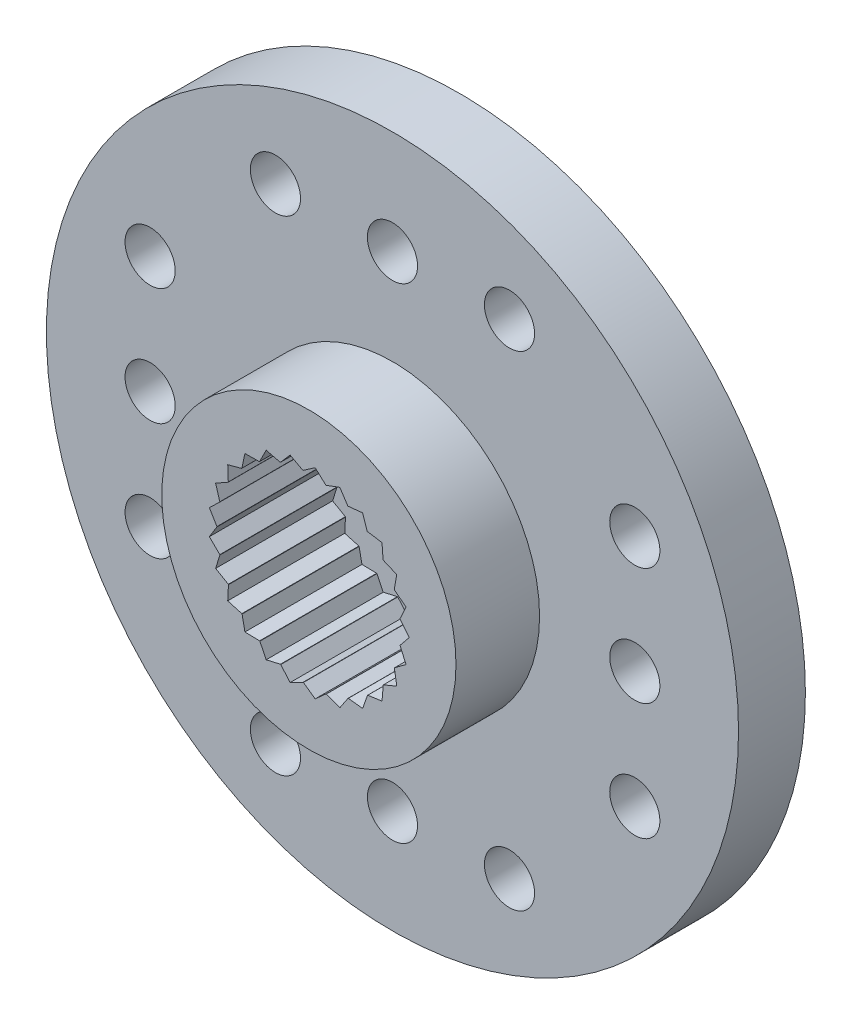
from build123d import *

# Parameters (mm, degrees)
SKETCH1_R             = 10.35
SKETCH1_R_2           = 4.4
SKETCH1_R_3           = 0.75
BOSS_EXTRUDE1_DEPTH   = 2
CIRPATTERN2_OUTLINE_R = 0.75
CIRPATTERN2_DEPTH     = 2
SKETCH1_2_R           = 4.4
BOSS_EXTRUDE2_DEPTH   = 4.5
SKETCH2_R             = 1.5
CUT_EXTRUDE1_DEPTH    = 4.5
SKETCH3_R             = 2.75
CUT_EXTRUDE2_DEPTH    = 3.5
CUT_EXTRUDE3_DEPTH    = 3.5
CIRPATTERN1_COUNT     = 25


# Read off the part's stored shape, not the designer's step: CirPattern2
with BuildPart() as part:
    # Sketch1 → Boss-Extrude1 (new body)
    with BuildSketch(Plane.XY):
        Circle(SKETCH1_R)
        Circle(SKETCH1_R_2, mode=Mode.SUBTRACT)
        with Locations((0, 7.247764581)):
            Circle(SKETCH1_R_3, mode=Mode.SUBTRACT)
        with Locations((3.5, 7.247764581)):
            Circle(SKETCH1_R_3, mode=Mode.SUBTRACT)
        with Locations((-3.5, 7.247764581)):
            Circle(SKETCH1_R_3, mode=Mode.SUBTRACT)
    extrude(amount=BOSS_EXTRUDE1_DEPTH)

    # CirPattern2 outline → CirPattern2 (cut)
    with BuildSketch(Plane.XY):
        with Locations((7.247764581, 3.5)):
            Circle(CIRPATTERN2_OUTLINE_R)
        with Locations((7.247764581, 0)):
            Circle(CIRPATTERN2_OUTLINE_R)
        with Locations((7.247764581, -3.5)):
            Circle(CIRPATTERN2_OUTLINE_R)
        with Locations((3.5, -7.247764581)):
            Circle(CIRPATTERN2_OUTLINE_R)
        with Locations((0, -7.247764581)):
            Circle(CIRPATTERN2_OUTLINE_R)
        with Locations((-3.5, -7.247764581)):
            Circle(CIRPATTERN2_OUTLINE_R)
        with Locations((-7.247764581, -3.5)):
            Circle(CIRPATTERN2_OUTLINE_R)
        with Locations((-7.247764581, 0)):
            Circle(CIRPATTERN2_OUTLINE_R)
        with Locations((-7.247764581, 3.5)):
            Circle(CIRPATTERN2_OUTLINE_R)
    extrude(amount=CIRPATTERN2_DEPTH, mode=Mode.SUBTRACT)

    # Sketch1<2> → Boss-Extrude2 (add)
    with BuildSketch(Plane.XY):
        Circle(SKETCH1_2_R)
    extrude(amount=BOSS_EXTRUDE2_DEPTH)

    # Sketch2 → Cut-Extrude1 (cut)
    with BuildSketch(Plane(origin=(0, 0, 0), x_dir=(-1, 0, 0), z_dir=(0, 0, -1))):
        Circle(SKETCH2_R)
    extrude(amount=-CUT_EXTRUDE1_DEPTH, mode=Mode.SUBTRACT)

    # Sketch3 → Cut-Extrude2 (cut)
    with BuildSketch(Plane.XY.offset(4.5)):
        Circle(SKETCH3_R)
    extrude(amount=-CUT_EXTRUDE2_DEPTH, mode=Mode.SUBTRACT)

    # Sketch4 → Cut-Extrude3 (cut)
    with BuildSketch(Plane.XY.offset(4.5)):
        with BuildLine():
            Line((-2.976344104, 0.375999701), (-2.728315429, 0.344666392))
            ThreePointArc((-2.728315429, 0.344666392), (-2.70218519, 0.510583192), (-2.665974712, 0.674595311))
            Line((-2.665974712, 0.674595311), (-2.976344104, 0.375999701))
        make_face()
        with BuildLine():
            Line((-2.976344104, 0.375999701), (-2.75, 0))
            ThreePointArc((-2.75, 0), (-2.744573503, 0.172673929), (-2.728315429, 0.344666392))
            Line((-2.728315429, 0.344666392), (-2.976344104, 0.375999701))
        make_face()
    cut_extrude3 = extrude(amount=-CUT_EXTRUDE3_DEPTH, mode=Mode.SUBTRACT)

    # CirPattern1: Cut-Extrude3 ×25 about axis
    cirpattern1_axis = Axis((0, 0, 0), (0, 0, 1))
    for i in range(1, CIRPATTERN1_COUNT):
        add(cut_extrude3.rotate(cirpattern1_axis, i * 360 / CIRPATTERN1_COUNT), mode=Mode.SUBTRACT)


solid = part.part
